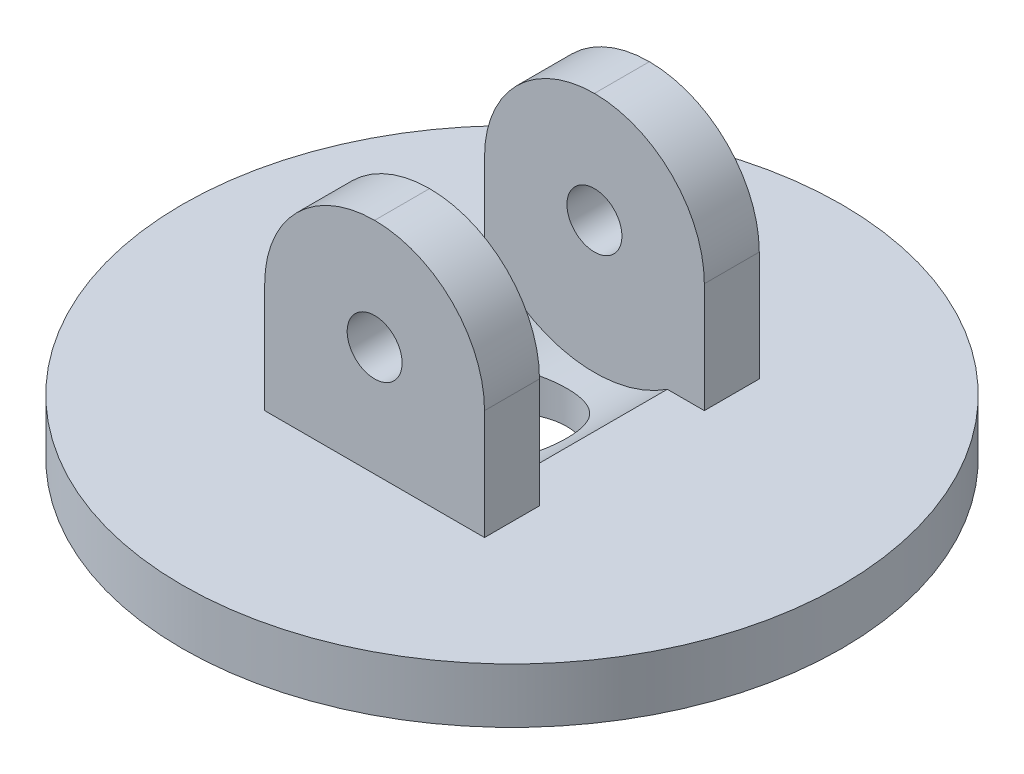
from build123d import *

# Parameters (mm, degrees)
SKIZZE1_R                       = 60
AUFSATZ_LINEAR_AUSTRAGEN1_DEPTH = 10
SKIZZE2_W                       = 40
SKIZZE2_H                       = 10
AUFSATZ_LINEAR_AUSTRAGEN2_DEPTH = 40
VERRUNDUNG1_R                   = 20
SKIZZE3_R                       = 5
SCHNITT_LINEAR_AUSTRAGEN1_DEPTH = 116.433963806
SKIZZE4_R                       = 10
SCHNITT_LINEAR_AUSTRAGEN2_DEPTH = 10
SKIZZE5_R                       = 24
SCHNITT_LINEAR_AUSTRAGEN3_DEPTH = 30


with BuildPart() as part:
    # Skizze1 → Aufsatz-Linear austragen1 (new body)
    with BuildSketch(Plane(origin=(0, 0, 0), x_dir=(1, 0, 0), z_dir=(0, 1, 0))):
        with Locations(Location((0, 0, 0), (0, 0, 270))):
            Circle(SKIZZE1_R)
    extrude(amount=AUFSATZ_LINEAR_AUSTRAGEN1_DEPTH)

    # Skizze2 → Aufsatz-Linear austragen2 (add)
    with BuildSketch(Plane(origin=(0, 10, 0), x_dir=(1, 0, 0), z_dir=(0, 1, 0))):
        with Locations((0, -20)):
            Rectangle(SKIZZE2_W, SKIZZE2_H)
        with Locations((0, 20)):
            Rectangle(SKIZZE2_W, SKIZZE2_H)
    extrude(amount=AUFSATZ_LINEAR_AUSTRAGEN2_DEPTH)

    # Verrundung1
    verrundung1_edges = [part.edges().sort_by_distance(p)[0] for p in [
        (20, 50, -20),
        (20, 50, 20),
        (-20, 50, 20),
        (-20, 50, -20),
    ]]
    fillet(verrundung1_edges, radius=VERRUNDUNG1_R - 0.0001)  # a hair under: the kernel refuses the full size

    # Skizze3 → Schnitt-Linear austragen1 (cut, through all)
    with BuildSketch(Plane(origin=(0, 0, -25), x_dir=(-1, 0, 0), z_dir=(0, 0, -1))):
        with Locations((0, 30)):
            Circle(SKIZZE3_R)
    extrude(amount=-SCHNITT_LINEAR_AUSTRAGEN1_DEPTH, mode=Mode.SUBTRACT)

    # Skizze4 → Schnitt-Linear austragen2 (cut)
    with BuildSketch(Plane(origin=(0, 10, 0), x_dir=(1, 0, 0), z_dir=(0, 1, 0))):
        with Locations(Location((0, 0, 0), (0, 0, 270))):
            Circle(SKIZZE4_R)
    extrude(amount=-SCHNITT_LINEAR_AUSTRAGEN2_DEPTH, mode=Mode.SUBTRACT)

    # Skizze5 → Schnitt-Linear austragen3 (cut)
    with BuildSketch(Plane(origin=(0, 0, 15), x_dir=(-1, 0, 0), z_dir=(0, 0, -1))):
        with Locations((0, 30)):
            Circle(SKIZZE5_R)
    extrude(amount=SCHNITT_LINEAR_AUSTRAGEN3_DEPTH, mode=Mode.SUBTRACT)


solid = part.part
